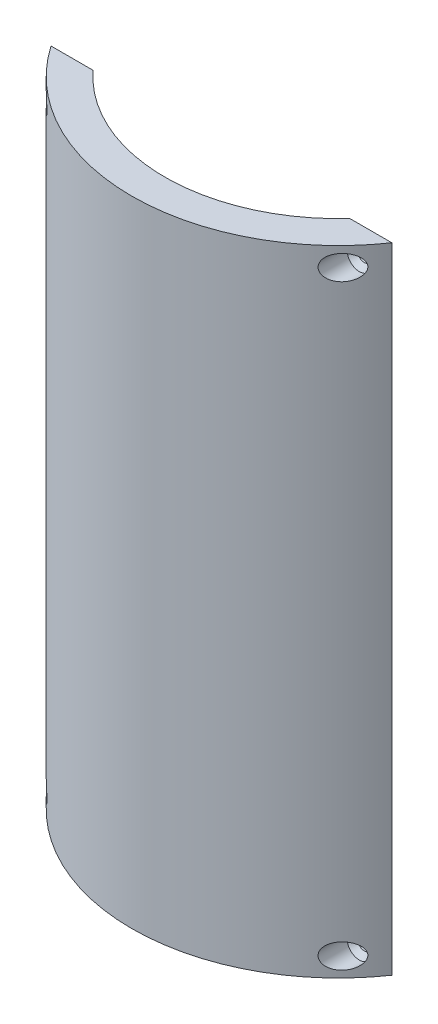
from build123d import *

# Parameters (mm, degrees)
BOSS_EXTRUDE1_DEPTH = 150


with BuildPart() as part:
    # Sketch1 → Boss-Extrude1 (new body)
    with BuildSketch(Plane(origin=(0, 0, 0), x_dir=(1, 0, 0), z_dir=(0, 1, 0))):
        with BuildLine():
            ThreePointArc((30.348758021, -27.696013052), (0, -41.086691914), (-30.348758021, -27.696013052))
            Line((-30.348758021, -27.696013052), (-40.294563976, -27.696013052))
            ThreePointArc((-40.294563976, -27.696013052), (0, -48.895), (40.294563976, -27.696013052))
            Line((40.294563976, -27.696013052), (30.348758021, -27.696013052))
        make_face()
    extrude(amount=BOSS_EXTRUDE1_DEPTH)

    # Sketch6 → Cut-Revolve4 (revolve, cut)
    with BuildSketch(Plane(origin=(34.962080117, 4.5125, 27.696013052), x_dir=(-1, 0, 0), z_dir=(0, -1, 0))):
        Polygon((0, 1.685394277), (0, -4.78184701), (0, -15.185924704), (-2.9, -15.185924704), (-2.9, -2.342375952), (-1.65, -1.145315212), (-1.65, 1.685394277), align=None)
    cut_revolve4 = revolve(axis=Axis((34.962080117, 4.5125, 26.010618776), (0, 0, 1)), mode=Mode.SUBTRACT)

    # Mirror1: Cut-Revolve4 across plane
    add(cut_revolve4.mirror(Plane(origin=(0, 75, 0), x_dir=(0, 0, 1), z_dir=(0, -1, 0))), mode=Mode.SUBTRACT)

    # Mirror1 at the second plane: Cut-Revolve4 across plane
    add(cut_revolve4.mirror(Plane(origin=(0, 0, 0), x_dir=(0, 0, 1), z_dir=(1, 0, 0))), mode=Mode.SUBTRACT)

    # Mirror1 at the second plane copy 1 sketc → Mirror1 at the second plane copy 1 (revolve, cut)
    with BuildSketch(Plane(origin=(-34.962080117, 145.4875, 27.696013052), x_dir=(1, 0, 0), z_dir=(0, 1, 0))):
        Polygon((0, 1.685394277), (0, -4.78184701), (0, -15.185924704), (-2.9, -15.185924704), (-2.9, -2.342375952), (-1.65, -1.145315212), (-1.65, 1.685394277), align=None)
    revolve(axis=Axis((-34.962080117, 145.4875, 26.010618776), (0, 0, 1)), mode=Mode.SUBTRACT)


solid = part.part
